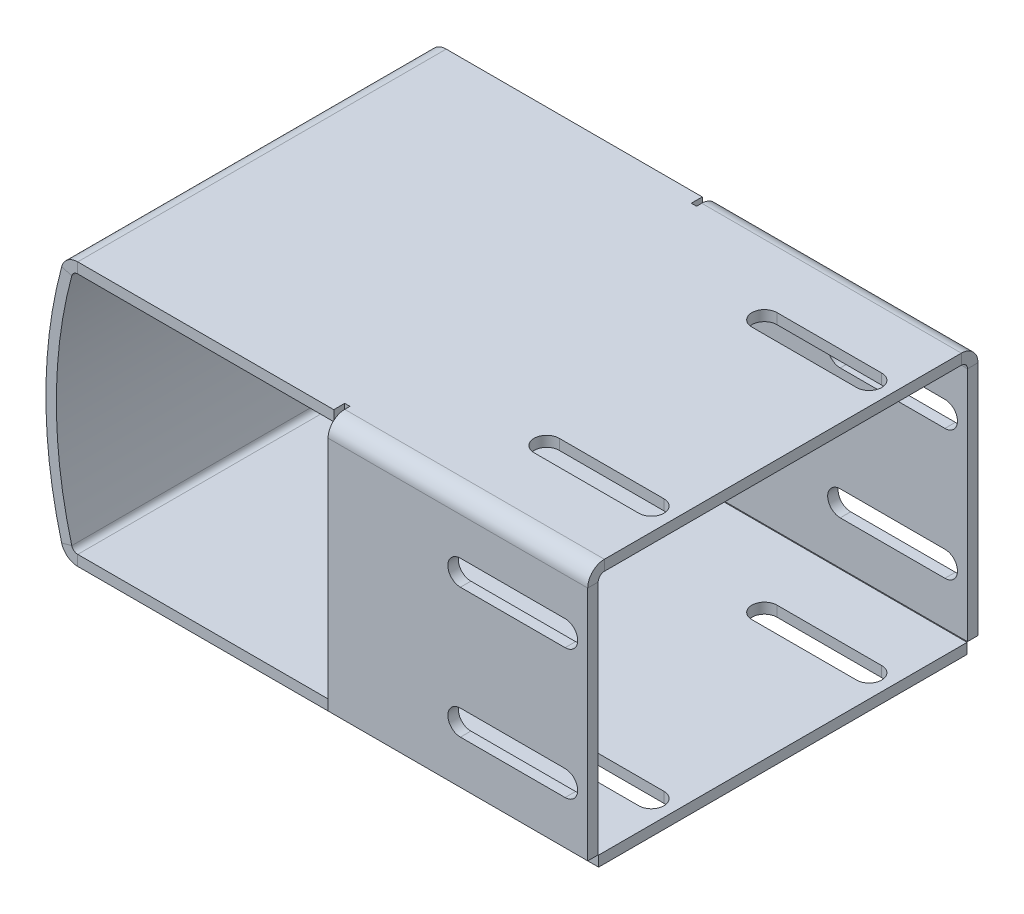
from build123d import *

# Parameters (mm, degrees)
BASE_FLANGE1_DEPTH            = 22
CUT_EXTRUDE1_DEPTH            = 62.294881516
CUT_EXTRUDE1_DEPTH_BACK       = 62.294881516
EDGE_FLANGE3_STRIP_W          = 6.5232
EDGE_FLANGE3_STRIP_H          = 1.25
EDGE_FLANGE3_STRIP_CUT_DEPTH  = 31
EDGE_FLANGE3_RELIEF_W         = 7.1482
EDGE_FLANGE3_RELIEF_H         = 0.625
EDGE_FLANGE3_RELIEF_CUT_DEPTH = 1.25
EDGE_FLANGE3_DEPTH            = 31
CUT_EXTRUDE2_DEPTH            = 62.773396377


# Read off the part's stored shape, not the designer's step: Base-Flange1
# Sheet-metal steps are written as plain solids
with BuildPart() as part:
    # Base-Flange1 outline → Base-Flange1 (new body)
    with BuildSketch(Plane.XY):
        with BuildLine():
            Line((-51.19559942, 14.5), (11, 14.5))
            Line((11, 14.5), (11, 15.75))
            Line((11, 15.75), (-51.19559942, 15.75))
            ThreePointArc((-51.19559942, 15.75), (-52.404310309, 15.339977796), (-53.114079989, 14.279163381))
            ThreePointArc((-53.114079989, 14.279163381), (-55, 0), (-53.114079989, -14.279163381))
            ThreePointArc((-53.114079989, -14.279163381), (-52.404310309, -15.339977796), (-51.19559942, -15.75))
            Line((-51.19559942, -15.75), (11, -15.75))
            Line((11, -15.75), (11, -14.5))
            Line((11, -14.5), (-51.19559942, -14.5))
            ThreePointArc((-51.19559942, -14.5), (-51.643770386, -14.347970223), (-51.906941808, -13.954636941))
            ThreePointArc((-51.906941808, -13.954636941), (-53.75, 0), (-51.906941808, 13.954636941))
            ThreePointArc((-51.906941808, 13.954636941), (-51.643770386, 14.347970223), (-51.19559942, 14.5))
        make_face()
    extrude(amount=BASE_FLANGE1_DEPTH)

    # Sketch2 → Cut-Extrude1 (cut, two sides: drawn at the far end of the back side and taken through both)
    with BuildSketch(Plane(origin=(0, 0, 0), x_dir=(1, 0, 0), z_dir=(0, 1, 0)).offset(-CUT_EXTRUDE1_DEPTH_BACK)):
        with BuildLine():
            Line((8.3, -11.5), (-4.2, -11.5))
            ThreePointArc((-4.2, -11.5), (-5.7, -13), (-4.2, -14.5))
            Line((-4.2, -14.5), (8.3, -14.5))
            ThreePointArc((8.3, -14.5), (9.8, -13), (8.3, -11.5))
        make_face()
        with BuildLine():
            Line((8.3, 14.5), (-4.2, 14.5))
            ThreePointArc((-4.2, 14.5), (-5.7, 13), (-4.2, 11.5))
            Line((-4.2, 11.5), (8.3, 11.5))
            ThreePointArc((8.3, 11.5), (9.8, 13), (8.3, 14.5))
        make_face()
    extrude(amount=CUT_EXTRUDE1_DEPTH + CUT_EXTRUDE1_DEPTH_BACK, mode=Mode.SUBTRACT)

    # Edge-Flange3 strip (across the edge) → Edge-Flange3 strip cut (cut)
    with BuildSketch(Plane(origin=(11, 14.5, 22.05), x_dir=(0, 0, -1), z_dir=(-1, 0, 0))):
        with Locations((-2.525, -0.625)):
            Rectangle(EDGE_FLANGE3_STRIP_W, EDGE_FLANGE3_STRIP_H)
    extrude(amount=EDGE_FLANGE3_STRIP_CUT_DEPTH, mode=Mode.SUBTRACT)

    # Edge-Flange3 relief (on the sheet) → Edge-Flange3 relief cut (cut)
    with BuildSketch(Plane(origin=(11, 14.5, 21.3134), x_dir=(0, 0, -1), z_dir=(0, -1, 0))):
        with Locations((-2.9491, -31.3125)):
            Rectangle(EDGE_FLANGE3_RELIEF_W, EDGE_FLANGE3_RELIEF_H)
    extrude(amount=-EDGE_FLANGE3_RELIEF_CUT_DEPTH, mode=Mode.SUBTRACT)

    # Edge-Flange3 section (across the edge) → Edge-Flange3 (add)
    with BuildSketch(Plane(origin=(11, 14.5, 22.05), x_dir=(0, 0, -1), z_dir=(-1, 0, 0))):
        with BuildLine():
            Line((-1.25, 0.7366), (-1.25, 28.95))
            Line((-1.25, 28.95), (0, 28.95))
            Line((0, 28.95), (0, 0.7366))
            ThreePointArc((0, 0.7366), (0.215745145, 0.215745145), (0.7366, 0))
            Line((0.7366, 0), (0.7366, -1.25))
            ThreePointArc((0.7366, -1.25), (-0.668138332, -0.668138332), (-1.25, 0.7366))
        make_face()
    extrude(amount=EDGE_FLANGE3_DEPTH)

    # Sketch29 → Cut-Extrude2 (cut, through all)
    with BuildSketch(Plane.XY.offset(23.3)):
        with BuildLine():
            Line((8.3, -6.25), (-4.2, -6.25))
            ThreePointArc((-4.2, -6.25), (-5.7, -7.75), (-4.2, -9.25))
            Line((-4.2, -9.25), (8.3, -9.25))
            ThreePointArc((8.3, -9.25), (9.8, -7.75), (8.3, -6.25))
        make_face()
        with BuildLine():
            Line((8.3, 6.25), (-4.2, 6.25))
            ThreePointArc((-4.2, 6.25), (-5.7, 7.75), (-4.2, 9.25))
            Line((-4.2, 9.25), (8.3, 9.25))
            ThreePointArc((8.3, 9.25), (9.8, 7.75), (8.3, 6.25))
        make_face()
    extrude(amount=-CUT_EXTRUDE2_DEPTH, mode=Mode.SUBTRACT)

    # Mirror1: part across plane


with BuildPart() as part_1:
    add(part.part)
    add(part.part.mirror(Plane(origin=(-51.906941808, -13.954636941, 0), x_dir=(1, 0, 0), z_dir=(0, 0, -1))))


solid = part_1.part
